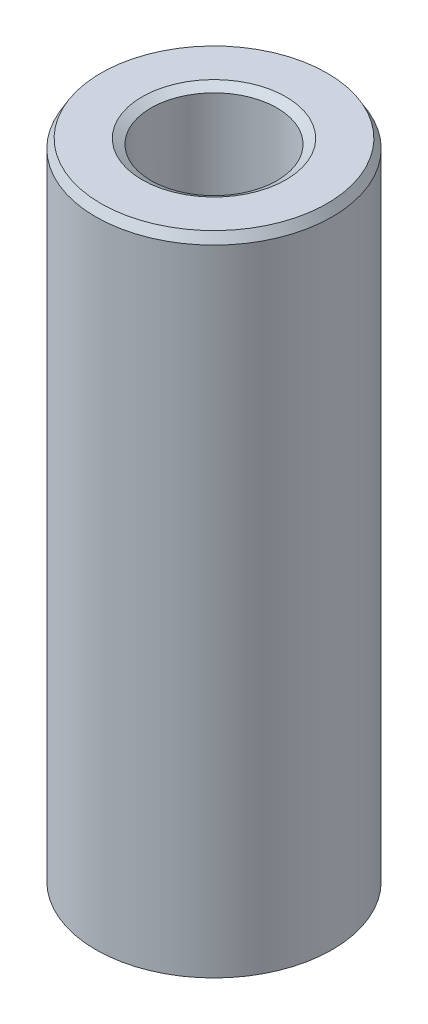
from build123d import *
from OCP.BRepFilletAPI import BRepFilletAPI_MakeChamfer

# Parameters (mm, degrees)
SKETCH1_R           = 45
BOSS_EXTRUDE1_DEPTH = 246.915724607
SKETCH2_R           = 23.978225621
CUT_EXTRUDE1_DEPTH  = 255.985048696
CHAMFER1_SIZE       = 3.401728638
CHAMFER1_SIZE2      = 1.963988945


with BuildPart() as part:
    # Sketch1 → Boss-Extrude1 (new body)
    with BuildSketch(Plane(origin=(0, 0, 0), x_dir=(1, 0, 0), z_dir=(0, 1, 0))):
        Circle(SKETCH1_R)
    extrude(amount=BOSS_EXTRUDE1_DEPTH)

    # Sketch2 → Cut-Extrude1 (cut, through all)
    with BuildSketch(Plane(origin=(0, 0, 0), x_dir=(1, 0, 0), z_dir=(0, 1, 0))):
        Circle(SKETCH2_R)
    extrude(amount=CUT_EXTRUDE1_DEPTH, mode=Mode.SUBTRACT)

    # Chamfer1: one chamfer whose edges measure the first distance from different faces: ONE call of the kernel's chamfer builder (chamfer() names one face for all edges)
    chamfer1_edges_1 = [part.edges().sort_by_distance(p)[0] for p in [
        (-23.978225621, 246.915724607, 0),
    ]]
    chamfer1_side_1 = [part.faces().sort_by_distance(p)[0] for p in [
        (-43.727207794, 246.915724607, 0),
    ]]
    chamfer1_edges_2 = [part.edges().sort_by_distance(p)[0] for p in [
        (-23.978225621, 0, 0),
    ]]
    chamfer1_side_2 = [part.faces().sort_by_distance(p)[0] for p in [
        (-23.978225621, 123.457862304, 0),
    ]]
    chamfer1_edges_3 = [part.edges().sort_by_distance(p)[0] for p in [
        (-45, 0, 0),
    ]]
    chamfer1_side_3 = [part.faces().sort_by_distance(p)[0] for p in [
        (-43.727207794, 0, 0),
    ]]
    chamfer1_edges_4 = [part.edges().sort_by_distance(p)[0] for p in [
        (-45, 246.915724607, 0),
    ]]
    chamfer1_side_4 = [part.faces().sort_by_distance(p)[0] for p in [
        (-45, 123.457862304, 0),
    ]]
    chamfer1 = BRepFilletAPI_MakeChamfer(part.part.solid().wrapped)
    for e in chamfer1_edges_1:
        chamfer1.Add(CHAMFER1_SIZE, CHAMFER1_SIZE2, e.wrapped, chamfer1_side_1[0].wrapped)  # the first distance lies on this face
    for e in chamfer1_edges_2:
        chamfer1.Add(CHAMFER1_SIZE, CHAMFER1_SIZE2, e.wrapped, chamfer1_side_2[0].wrapped)  # the first distance lies on this face
    for e in chamfer1_edges_3:
        chamfer1.Add(CHAMFER1_SIZE, CHAMFER1_SIZE2, e.wrapped, chamfer1_side_3[0].wrapped)  # the first distance lies on this face
    for e in chamfer1_edges_4:
        chamfer1.Add(CHAMFER1_SIZE, CHAMFER1_SIZE2, e.wrapped, chamfer1_side_4[0].wrapped)  # the first distance lies on this face
    add(Compound.cast(chamfer1.Shape()), mode=Mode.REPLACE)


solid = part.part
